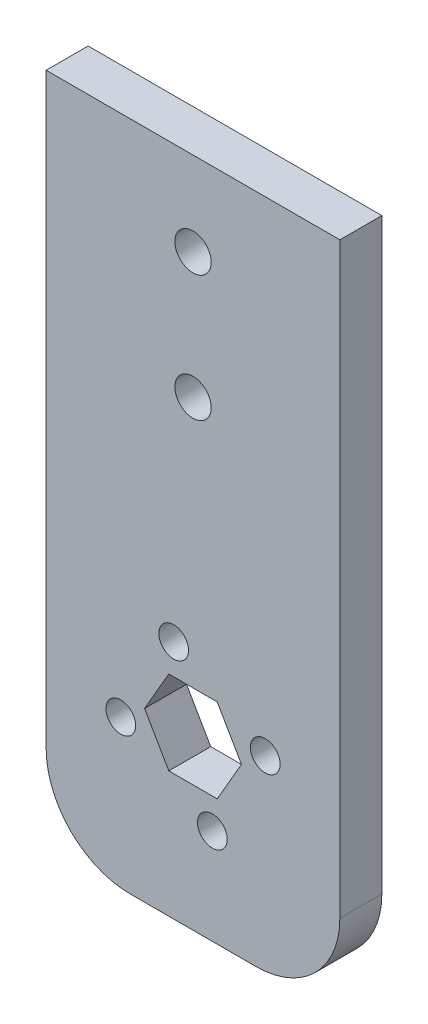
from build123d import *

# Parameters (mm, degrees)
SKETCH1_W            = 44.45
SKETCH1_H            = 101.6
BOSS_EXTRUDE2_DEPTH  = 6.35
FILLET1_R            = 12.7
M5_CLEARANCE_HOLE1_D = 5.5
CUT_EXTRUDE1_DEPTH   = 112.079633597
M4_CLEARANCE_HOLE1_D = 4.5


with BuildPart() as part:
    # Sketch1 → Boss-Extrude2 (new body)
    with BuildSketch(Plane.XY):
        with Locations((-22.225, 50.8)):
            Rectangle(SKETCH1_W, SKETCH1_H)
    extrude(amount=BOSS_EXTRUDE2_DEPTH)

    # Fillet1
    fillet1_edges = [part.edges().sort_by_distance(p)[0] for p in [
        (-44.45, 0, 3.175),
        (0, 0, 3.175),
    ]]
    fillet(fillet1_edges, radius=FILLET1_R)

    # M5 Clearance Hole1 (through all)
    with Locations(Plane(origin=(0, 0, 0), x_dir=(-1, 0, 0), z_dir=(0, 0, -1))):
        with Locations((22.225, 88.9), (22.225, 69.85)):
            Hole(M5_CLEARANCE_HOLE1_D / 2)

    # Sketch14 → Cut-Extrude1 (cut, through all)
    with BuildSketch(Plane.XY.offset(6.35)):
        Polygon((-14.892651581, 25.4), (-18.558825791, 31.75), (-25.891174209, 31.75), (-29.557348419, 25.4), (-25.891174209, 19.05), (-18.558825791, 19.05), align=None)
    extrude(amount=-CUT_EXTRUDE1_DEPTH, mode=Mode.SUBTRACT)

    # M4 Clearance Hole1 (through all)
    with Locations(Plane(origin=(0, 0, 0), x_dir=(-1, 0, 0), z_dir=(0, 0, -1))):
        with Locations((11.29679677, 28.32820323), (25.15320323, 36.32820323), (33.15320323, 22.47179677), (19.29679677, 14.47179677)):
            Hole(M4_CLEARANCE_HOLE1_D / 2)


solid = part.part
